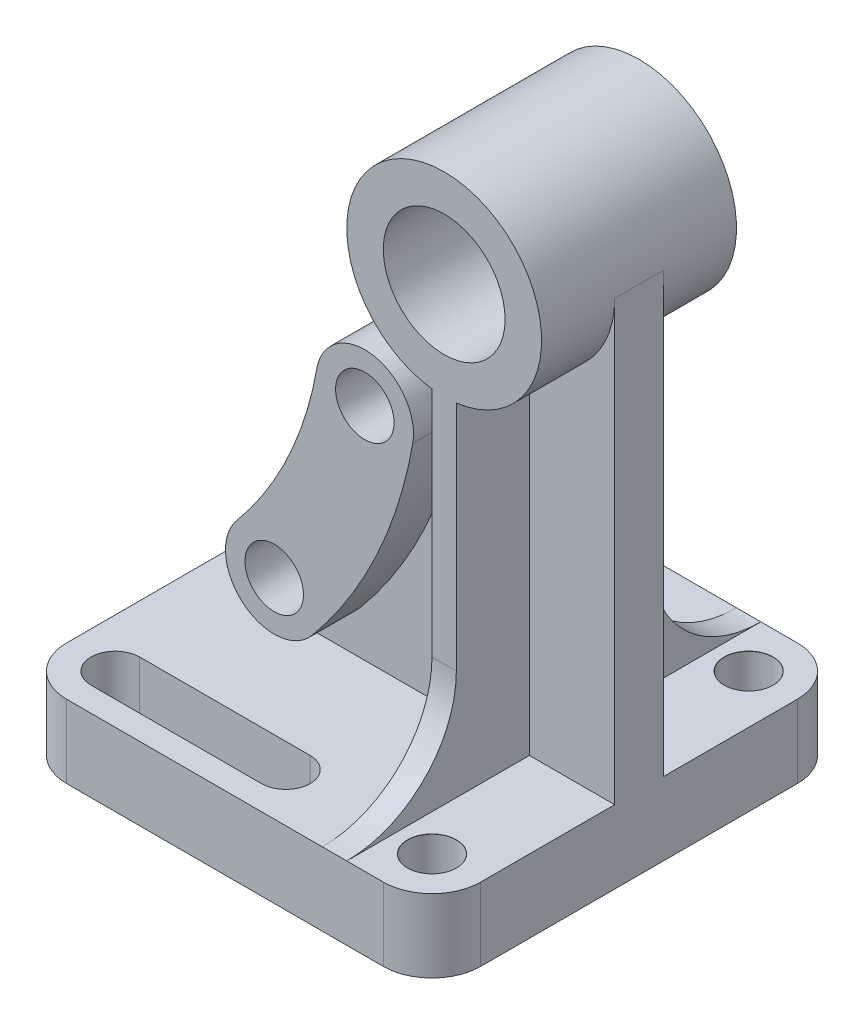
from build123d import *

# Parameters (mm, degrees)
SKETCH1_W                            = 85
SKETCH1_H                            = 85
BOSS_EXTRUDE1_DEPTH                  = 15
SKETCH2_R                            = 20
BOSS_EXTRUDE2_DEPTH                  = 20
BOSS_EXTRUDE3_DEPTH                  = 5
BOSS_EXTRUDE4_DEPTH                  = 15
RIB1_START                           = -2.5
RIB1_DEPTH                           = 5
FILLET1_R                            = 10
F_10_0_10_DIAMETER_HOLE1_D           = 10
F_10_0_10_DIAMETER_HOLE1_CSINK_D     = 10.05
F_10_0_10_DIAMETER_HOLE1_CSINK_ANGLE = 90
CUT_EXTRUDE1_DEPTH                   = 126.349511367
CUT_EXTRUDE1_DEPTH_BACK              = 126.349511367
CUT_EXTRUDE2_DEPTH                   = 145.005208239
CUT_EXTRUDE2_DEPTH_BACK              = 145.005208239
SKETCH9_R                            = 12.5
SKETCH9_R_2                          = 6


with BuildPart() as part:
    # Sketch1 → Boss-Extrude1 (new body)
    with BuildSketch(Plane(origin=(0, 0, 0), x_dir=(1, 0, 0), z_dir=(0, 1, 0))):
        Rectangle(SKETCH1_W, SKETCH1_H)
    extrude(amount=BOSS_EXTRUDE1_DEPTH)



with BuildPart() as body_2:
    # Sketch2 → Boss-Extrude2 (new, symmetric)
    with BuildSketch(Plane.XY):
        with Locations((22.5, 105)):
            Circle(SKETCH2_R)
    extrude(amount=BOSS_EXTRUDE2_DEPTH, both=True)


with BuildPart() as part_1:
    add(part.part)

    add(body_2.part)  # Boss-Extrude3 merges body 2
    # Sketch4 → Boss-Extrude3 (add, symmetric)
    with BuildSketch(Plane.XY):
        with BuildLine():
            Line((42.5, 105), (42.5, 15))
            Line((42.5, 15), (-34.281746195, 15))
            ThreePointArc((-34.281746195, 15), (-7.255227512, 45.462369655), (2.5, 85))
            Line((2.5, 85), (2.5, 105))
            ThreePointArc((2.5, 105), (22.5, 85), (42.5, 105))
        make_face()
    extrude(amount=BOSS_EXTRUDE3_DEPTH, both=True)

    # Sketch5 → Boss-Extrude4 (add, symmetric)
    with BuildSketch(Plane.XY):
        with BuildLine():
            ThreePointArc((-9.725777904, 23.93517708), (3.599239768, 44.851265135), (11.056736536, 68.503423122))
            ThreePointArc((11.056736536, 68.503423122), (2.945140783, 80.087982428), (-8.639418524, 71.976386675))
            ThreePointArc((-8.639418524, 71.976386675), (-14.526915972, 53.303630369), (-25.046666766, 36.790929274))
            ThreePointArc((-25.046666766, 36.790929274), (-23.814098432, 22.702608745), (-9.725777904, 23.93517708))
        make_face()
    extrude(amount=BOSS_EXTRUDE4_DEPTH, both=True)

    # Rib1: read off the stored shape, not the designer's step
    # Rib1 outline → Rib1 (add)
    with BuildSketch(Plane(origin=(22.5, 0, 0), x_dir=(0, 0, -1), z_dir=(1, 0, 0)).offset(RIB1_START)):
        with BuildLine():
            Line((-5, 15), (-5, 85.156865167))
            Line((-5, 85.156865167), (-20, 85.156865167))
            Line((-20, 85.156865167), (-20, 37.5))
            ThreePointArc((-20, 37.5), (-26.590097423, 21.590097423), (-42.5, 15))
            Line((-42.5, 15), (-5, 15))
        make_face()
    rib1 = extrude(amount=RIB1_DEPTH)

    # Mirror1: Rib1 across plane
    add(rib1.mirror(Plane.XY))

    # Fillet1
    fillet1_edges = [part_1.edges().sort_by_distance(p)[0] for p in [
        (42.5, 7.5, 42.5),
        (-42.5, 7.5, 42.5),
        (-42.5, 7.5, -42.5),
        (42.5, 7.5, -42.5),
    ]]
    fillet(fillet1_edges, radius=FILLET1_R)

    # Ø10.0 (10) Diameter Hole1 (through all)
    with Locations(Plane(origin=(32.5, 15, -32.5), x_dir=(0, 0, 1), z_dir=(0, 1, 0))):
        with Locations((0, 0), (65, 0)):
            CounterSinkHole(F_10_0_10_DIAMETER_HOLE1_D / 2, F_10_0_10_DIAMETER_HOLE1_CSINK_D / 2, counter_sink_angle=F_10_0_10_DIAMETER_HOLE1_CSINK_ANGLE)

    # Sketch8 → Cut-Extrude1 (cut, two sides: drawn at the far end of the back side and taken through both)
    with BuildSketch(Plane(origin=(0, 15, 0), x_dir=(1, 0, 0), z_dir=(0, 1, 0)).offset(-CUT_EXTRUDE1_DEPTH_BACK)):
        with BuildLine():
            Line((-32.5, -27.5), (2.5, -27.5))
            ThreePointArc((2.5, -27.5), (7.5, -32.5), (2.5, -37.5))
            Line((2.5, -37.5), (-32.5, -37.5))
            ThreePointArc((-32.5, -37.5), (-37.5, -32.5), (-32.5, -27.5))
        make_face()
        with BuildLine():
            Line((-32.5, 27.5), (2.5, 27.5))
            ThreePointArc((2.5, 27.5), (7.5, 32.5), (2.5, 37.5))
            Line((2.5, 37.5), (-32.5, 37.5))
            ThreePointArc((-32.5, 37.5), (-37.5, 32.5), (-32.5, 27.5))
        make_face()
    extrude(amount=CUT_EXTRUDE1_DEPTH + CUT_EXTRUDE1_DEPTH_BACK, mode=Mode.SUBTRACT)

    # Sketch9 → Cut-Extrude2 (cut, two sides: drawn at the far end of the back side and taken through both)
    with BuildSketch(Plane.XY.offset(15).offset(-CUT_EXTRUDE2_DEPTH_BACK)):
        with Locations((22.5, 105)):
            Circle(SKETCH9_R)
        with Locations((1.208659006, 70.239904898)):
            Circle(SKETCH9_R_2)
        with Locations((-17.386222335, 30.363053177)):
            Circle(SKETCH9_R_2)
    extrude(amount=CUT_EXTRUDE2_DEPTH + CUT_EXTRUDE2_DEPTH_BACK, mode=Mode.SUBTRACT)


solid = part_1.part
